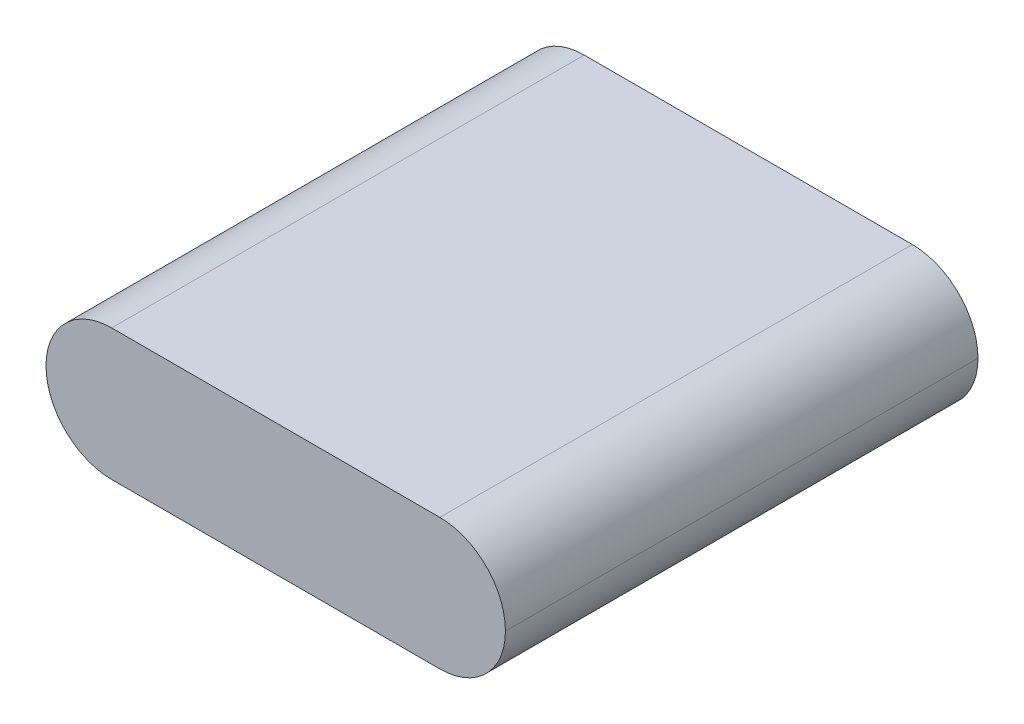
from build123d import *

# Parameters (mm, degrees)
SKETCH1_W           = 70
SKETCH1_H           = 72
BOSS_EXTRUDE1_DEPTH = 20
FILLET1_R           = 10


with BuildPart() as part:
    # Sketch1 → Boss-Extrude1 (new body)
    with BuildSketch(Plane(origin=(0, 0, 0), x_dir=(1, 0, 0), z_dir=(0, 1, 0))):
        with Locations((35, 36)):
            Rectangle(SKETCH1_W, SKETCH1_H)
    extrude(amount=BOSS_EXTRUDE1_DEPTH)

    # Fillet1
    fillet1_edges = [part.edges().sort_by_distance(p)[0] for p in [
        (0, 0, -36),
        (70, 0, -36),
        (70, 20, -36),
        (0, 20, -36),
    ]]
    fillet(fillet1_edges, radius=FILLET1_R - 0.0001)  # a hair under: the kernel refuses the full size


solid = part.part
